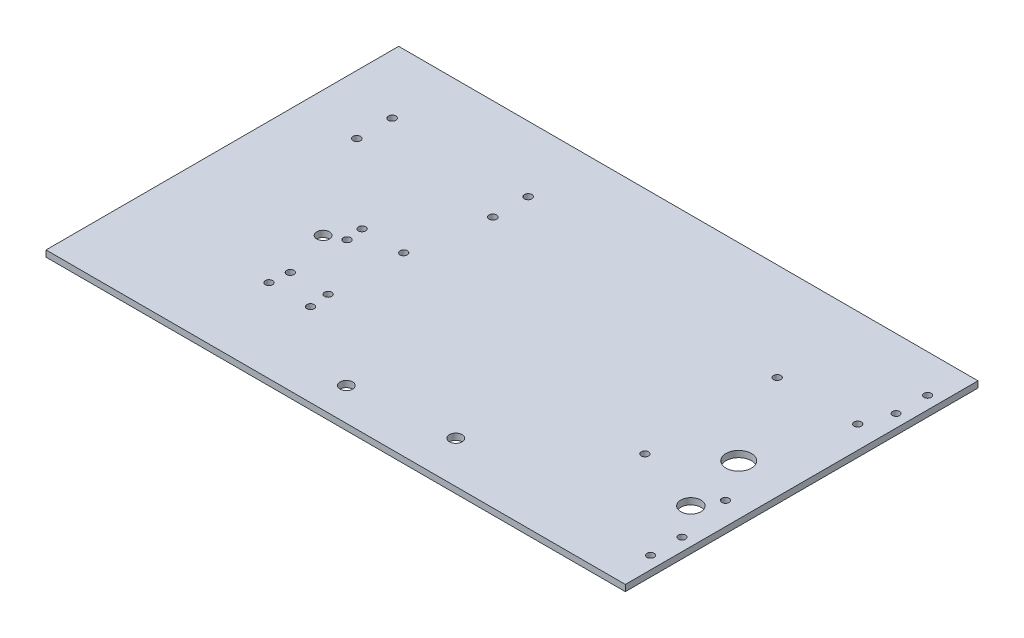
from build123d import *

# Parameters (mm, degrees)
SKETCH1_W           = 317.5
SKETCH1_H           = 177.8
SKETCH1_R           = 3.175
SKETCH1_R_2         = 6.4135
SKETCH1_R_3         = 1.905
BOSS_EXTRUDE1_DEPTH = 3.175
SKETCH3_R           = 3.175
CUT_EXTRUDE2_DEPTH  = 182.974869488
SKETCH4_W           = 25.4
SKETCH4_H           = 177.8
CUT_EXTRUDE3_DEPTH  = 182.974869488
SKETCH5_R           = 5.08
CUT_EXTRUDE4_DEPTH  = 182.974869488
SKETCH6_R           = 1.8034
CUT_EXTRUDE5_DEPTH  = 182.974869488
SKETCH7_R           = 1.8415
CUT_EXTRUDE6_DEPTH  = 182.974869488


with BuildPart() as part:
    # Sketch1 → Boss-Extrude1 (new body)
    with BuildSketch(Plane(origin=(0, 0, 0), x_dir=(1, 0, 0), z_dir=(0, 1, 0))):
        Rectangle(SKETCH1_W, SKETCH1_H)
        with Locations((-95.25, -12.7)):
            Circle(SKETCH1_R, mode=Mode.SUBTRACT)
        with Locations((107.95, -6.35)):
            Circle(SKETCH1_R_2, mode=Mode.SUBTRACT)
        with Locations((-129.032, 55.88)):
            Circle(SKETCH1_R_3, mode=Mode.SUBTRACT)
        with Locations((-60.452, 55.88)):
            Circle(SKETCH1_R_3, mode=Mode.SUBTRACT)
        with Locations((-129.032, 38.1)):
            Circle(SKETCH1_R_3, mode=Mode.SUBTRACT)
        with Locations((-60.452, 38.1)):
            Circle(SKETCH1_R_3, mode=Mode.SUBTRACT)
    extrude(amount=BOSS_EXTRUDE1_DEPTH)

    # Sketch3 → Cut-Extrude2 (cut, through all)
    with BuildSketch(Plane(origin=(0, 0, 0), x_dir=(-1, 0, 0), z_dir=(0, -1, 0))):
        with Locations((23.829539609, -72.39)):
            Circle(SKETCH3_R)
        with Locations((-26.764302072, -67.818)):
            Circle(SKETCH3_R)
    extrude(amount=-CUT_EXTRUDE2_DEPTH, mode=Mode.SUBTRACT)

    # Sketch4 → Cut-Extrude3 (cut, through all)
    with BuildSketch(Plane(origin=(0, 3.175, 0), x_dir=(1, 0, 0), z_dir=(0, 1, 0))):
        with Locations((146.05, 0)):
            Rectangle(SKETCH4_W, SKETCH4_H)
    extrude(amount=-CUT_EXTRUDE3_DEPTH, mode=Mode.SUBTRACT)

    # Sketch5 → Cut-Extrude4 (cut, through all)
    with BuildSketch(Plane(origin=(0, 3.175, 0), x_dir=(1, 0, 0), z_dir=(0, 1, 0))):
        with Locations((115.57, -38.1)):
            Circle(SKETCH5_R)
    extrude(amount=-CUT_EXTRUDE4_DEPTH, mode=Mode.SUBTRACT)

    # Sketch6 → Cut-Extrude5 (cut, through all)
    with BuildSketch(Plane.XZ):
        with Locations((127, 69.85)):
            Circle(SKETCH6_R)
        with Locations((127, 53.975)):
            Circle(SKETCH6_R)
        with Locations((127, -53.975)):
            Circle(SKETCH6_R)
        with Locations((127, -69.85)):
            Circle(SKETCH6_R)
    extrude(amount=-CUT_EXTRUDE5_DEPTH, mode=Mode.SUBTRACT)

    # Sketch7 → Cut-Extrude6 (cut, through all)
    with BuildSketch(Plane(origin=(0, 3.175, 0), x_dir=(1, 0, 0), z_dir=(0, 1, 0))):
        with Locations((121.92, 39.6875)):
            Circle(SKETCH7_R)
        with Locations((81.28, 39.6875)):
            Circle(SKETCH7_R)
        with Locations((81.28, -26.9875)):
            Circle(SKETCH7_R)
        with Locations((121.92, -26.9875)):
            Circle(SKETCH7_R)
        with Locations((-88.265, -46.99)):
            Circle(SKETCH7_R)
        with Locations((-67.31, -46.99)):
            Circle(SKETCH7_R)
        with Locations((-87.3125, -37.1475)):
            Circle(SKETCH7_R)
        with Locations((-68.2625, -37.1475)):
            Circle(SKETCH7_R)
        with Locations((-87.3125, -8.5725)):
            Circle(SKETCH7_R)
        with Locations((-88.265, 0)):
            Circle(SKETCH7_R)
        with Locations((-67.31, 0)):
            Circle(SKETCH7_R)
    extrude(amount=-CUT_EXTRUDE6_DEPTH, mode=Mode.SUBTRACT)


solid = part.part
